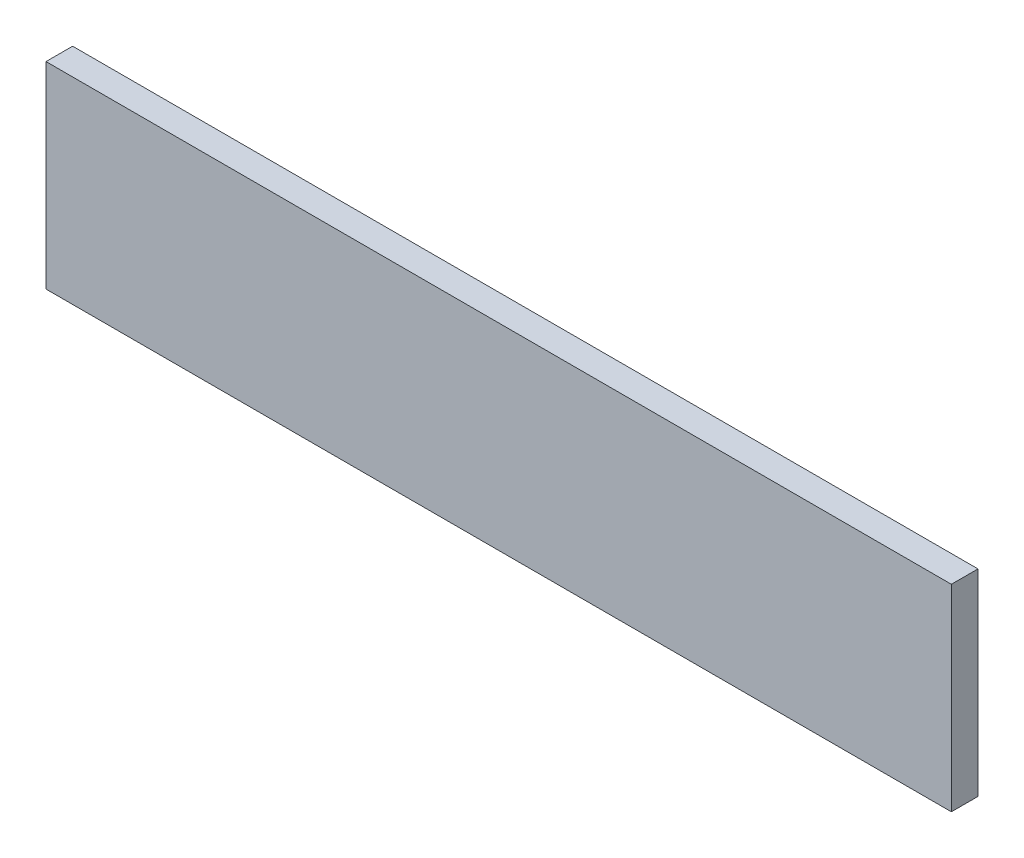
from build123d import *

# Parameters (mm, degrees)
SKETCH1_W           = 340
SKETCH1_H           = 74
BOSS_EXTRUDE1_DEPTH = 10


with BuildPart() as part:
    # Sketch1 → Boss-Extrude1 (new body)
    with BuildSketch(Plane.XY):
        with Locations((80, 30)):
            Rectangle(SKETCH1_W, SKETCH1_H)
    extrude(amount=BOSS_EXTRUDE1_DEPTH)


solid = part.part
